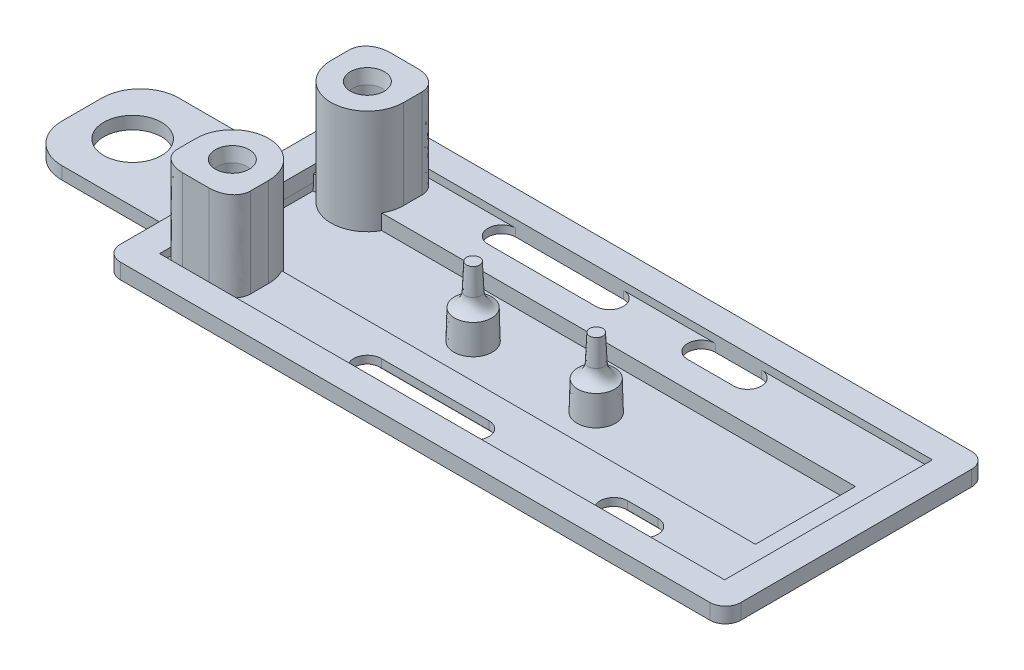
from build123d import *

# Parameters (mm, degrees)
MAINPERIMETER_DEPTH                = 2.54
FILLET1_R                          = 2.54
DEFINESDROPDOWN_DEPTH              = 8.255
FILLSINGAP_DEPTH                   = 2.54
COVERSOPENING_DEPTH                = 1.27
FILLET2_R                          = 3.81
SKETCH8_R                          = 1.587499999999992
TABS_FOR_PERFBOARD_DEPTH           = 11.43
TABS_FOR_PERFBOARD_DRAFT           = 2.5000000000000053
SKETCH8_R_2                        = 1.5875000000000052
TABS_FOR_PERFBOARD_PROFILE_2_DEPTH = 11.43
TABS_FOR_PERFBOARD_PROFILE_2_DRAFT = 2.5000000000000053
SKETCH30_R                         = 3.1750000000000003
BOSS_EXTRUDE12_DEPTH               = 4.826
BOSS_EXTRUDE12_DRAFT               = 1.5000000000000033
SKETCH30_R_2                       = 3.174999999999997
BOSS_EXTRUDE12_PROFILE_2_DEPTH     = 4.826
BOSS_EXTRUDE12_PROFILE_2_DRAFT     = 1.5000000000000033
FILLET6_R                          = 2.54
CUTS_OUT_ROOM_FOR_WIRES_DEPTH      = 1.27
CUT_EXTRUDE4_DEPTH                 = 121.34677900045737
CUT_EXTRUDE5_DEPTH                 = 121.34677906928141
BOSS_EXTRUDE8_START                = -1.27
BOSS_EXTRUDE8_DEPTH                = 15.999627777
BOSS_EXTRUDE8_START_2              = -2.5146
BOSS_EXTRUDE8_2_DEPTH              = 2.249007948
SKETCH16_R                         = 2.41499999999999
CUT_EXTRUDE6_DEPTH                 = 6.35
SKETCH17_R                         = 1.5000000000000018
CUT_EXTRUDE7_DEPTH                 = 1.27
BOSS_EXTRUDE9_START                = -0.265592052
BOSS_EXTRUDE9_DEPTH                = 14.995219829
BOSS_EXTRUDE9_START_2              = -2.5146
BOSS_EXTRUDE9_2_DEPTH              = 2.5146
SKETCH20_R                         = 2.415000000000003
CUT_EXTRUDE8_DEPTH                 = 6.35
SKETCH21_R                         = 1.5000000000000042
CUT_EXTRUDE9_DEPTH                 = 1.27
SKETCH24_W                         = 25.4
SKETCH24_H                         = 19.304000000000023
SKETCH24_R                         = 4.762500000000002
BOSS_EXTRUDE10_DEPTH               = 2.0828
BOSS_EXTRUDE11_REACH               = 137.209
SKETCH26_W                         = 19.304000000000023
SKETCH26_H                         = 2.0828
FILLET3_R                          = 6.35
FILLET5_R                          = 1.27
EXRTATHICKNESS_REACH               = 122.917


with BuildPart() as part:
    # Sketch1 → MainPerimeter (new body)
    with BuildSketch(Plane(origin=(0, 0, 0), x_dir=(1, 0, 0), z_dir=(0, 1, 0))):
        Polygon((-19.553975249358466, -43.67073320607621), (82.83002475064158, -43.67073320607621), (82.83002475064158, -86.85073320607621), (-19.55397524935846, -86.85073320607621), align=None)
        Polygon((-14.981975249358467, -48.24273320607621), (-14.981975249358463, -82.27873320607621), (78.25802475064158, -82.27873320607621), (78.25802475064158, -48.24273320607621), align=None, mode=Mode.SUBTRACT)
    extrude(amount=MAINPERIMETER_DEPTH)

    # Fillet1
    fillet1_edges = [part.edges().sort_by_distance(p)[0] for p in [
        (-19.553975249358466, 1.27, 43.67073320607621),
        (82.83002475064158, 1.27, 43.67073320607621),
        (82.83002475064158, 1.27, 86.85073320607621),
        (-19.55397524935846, 1.27, 86.85073320607621),
    ]]
    fillet(fillet1_edges, radius=FILLET1_R)

    # Sketch5 → DefinesDropDown (add, symmetric)
    with BuildSketch(Plane(origin=(0, 0, 65.26073320607621), x_dir=(-1, 0, 0), z_dir=(0, 0, -1))):
        Polygon((-82.83002475064158, 0), (-78.33192978860663, -3.1496), (15.05588028732352, -3.149599999999991), (19.553975249358466, 9.71e-15), (14.981975249358467, 8.59e-15), (15.05588028732352, -1.2445999999999913), (-78.33192978860663, -1.2446), (-78.25802475064158, 0), align=None)
    extrude(amount=DEFINESDROPDOWN_DEPTH, both=True)

    # Sketch6 → FillsInGap (add)
    with BuildSketch(Plane.XZ):
        Polygon((78.25802475064158, 57.005733206076215), (-14.981975249358468, 57.005733206076194), (-14.981975249358467, 48.24273320607621), (78.25802475064158, 48.24273320607622), align=None)
        Polygon((-14.981975249358463, 82.27873320607621), (78.25802475064158, 82.27873320607621), (78.25802475064158, 73.5157332060762), (-14.981975249358461, 73.51573320607619), align=None)
    extrude(amount=-FILLSINGAP_DEPTH)

    # Sketch7 → CoversOpening (add)
    with BuildSketch(Plane(origin=(0, 0, 57.005733206076215), x_dir=(-1, 0, 0), z_dir=(0, 0, -1))):
        Polygon((-78.25802475064158, 0), (14.981975249358465, 0), (19.553975249358462, 0), (15.05588028732352, -3.149599999999991), (-78.33192978860663, -3.1496), (-82.83002475064158, 0), align=None)
    coversopening = extrude(amount=COVERSOPENING_DEPTH)

    # Mirror1: CoversOpening across plane
    add(coversopening.mirror(Plane(origin=(0, 0, 65.26073320607621), x_dir=(1, 0, 0), z_dir=(0, 0, -1))))

    # Fillet2
    # the kernel refuses this fillet: 3.81 mm, written as the material it adds along each edge
    with BuildSketch(Plane(origin=(92.21084688945389, 0, 74.7857332060762), x_dir=(0, -1, 2.0304e-13), z_dir=(-1, 0, 0))) as fillet2_piece_1_section:
        with BuildLine():
            CenterArc((3.8100000000007617, 3.7523288555241487), FILLET2_R, 179.99999999998838, 80.0183170200956)
            Line((7.6187e-13, 3.7523288555249223), (0, 0))
            Line((0, 0), (3.1496000000001088, 0))
        make_face()
    fillet2_piece_1 = extrude(amount=121.14564427762464, mode=Mode.PRIVATE)
    fillet2_piece_1 = split(fillet2_piece_1, bisect_by=Plane(origin=(55.441346063389844, -52.512289313645795, 74.7857332060762), z_dir=(0.5735764363510469, 0.8191520442889914, 0)), keep=Keep.TOP, mode=Mode.PRIVATE)
    fillet2_piece_1 = split(fillet2_piece_1, bisect_by=Plane(origin=(89.12465088626233, 4.407544670373507, 74.7857332060762), z_dir=(-0.5735764363510469, 0.8191520442889912, 0)), keep=Keep.TOP, mode=Mode.PRIVATE)
    add(fillet2_piece_1)
    with BuildSketch(Plane(origin=(92.21084688945395, 0, 55.73573320607621), x_dir=(0, -1, -2.0981e-13), z_dir=(-1, 0, 0))) as fillet2_piece_2_section:
        with BuildLine():
            CenterArc((3.810000000000787, -3.7523288555241443), FILLET2_R, 99.98168297991637, 80.01831702009565)
            Line((7.8726e-13, -3.7523288555249437), (0, 0))
            Line((0, 0), (3.1496000000001123, 0))
        make_face()
    fillet2_piece_2 = extrude(amount=121.14564427762477, mode=Mode.PRIVATE)
    fillet2_piece_2 = split(fillet2_piece_2, bisect_by=Plane(origin=(55.44134606338988, -52.51228931364583, 55.73573320607621), z_dir=(0.5735764363510469, 0.8191520442889914, 0)), keep=Keep.TOP, mode=Mode.PRIVATE)
    fillet2_piece_2 = split(fillet2_piece_2, bisect_by=Plane(origin=(89.12465088626236, 4.407544670373534, 55.73573320607621), z_dir=(-0.5735764363510469, 0.8191520442889912, 0)), keep=Keep.TOP, mode=Mode.PRIVATE)
    add(fillet2_piece_2)


with BuildPart() as tabs_for_perfboard_tool:
    # Sketch8 → Tabs For PerfBoard (with draft: the straight prism first)
    with BuildSketch(Plane(origin=(-1.2e-16, -1.2445999999999926, 0), x_dir=(1, -1.2e-16, 0), z_dir=(1.2e-16, 1, 0))):
        with Locations((19.60802475064167, -65.26073320607618)):
            Circle(SKETCH8_R)
    extrude(amount=TABS_FOR_PERFBOARD_DEPTH)
    # Tabs For PerfBoard: the draft: its side faces are tilted about the plane it starts from
    tabs_for_perfboard_sides = [tabs_for_perfboard_tool.faces().sort_by_distance(p)[0] for p in [
        (18.020524751, 4.4704, 65.260733206),
    ]]
    draft(tabs_for_perfboard_sides, Plane(origin=(-1.2e-16, -1.2445999999999926, 0), x_dir=(1, -1.2e-16, 0), z_dir=(1.2e-16, 1, 0)), TABS_FOR_PERFBOARD_DRAFT)


with BuildPart() as part_1:
    add(part.part)

    # Tabs For PerfBoard: add tabs_for_perfboard_tool
    add(tabs_for_perfboard_tool.part)


with BuildPart() as tabs_for_perfboard_profile_2_tool:
    # Sketch8 → Tabs For PerfBoard profile 2 (with draft: the straight prism first)
    with BuildSketch(Plane(origin=(-1.2e-16, -1.2445999999999926, 0), x_dir=(1, -1.2e-16, 0), z_dir=(1.2e-16, 1, 0))):
        with Locations((39.928024750641605, -65.2607332060762)):
            Circle(SKETCH8_R_2)
    extrude(amount=TABS_FOR_PERFBOARD_PROFILE_2_DEPTH)
    # Tabs For PerfBoard profile 2: the draft: its side faces are tilted about the plane it starts from
    tabs_for_perfboard_profile_2_sides = [tabs_for_perfboard_profile_2_tool.faces().sort_by_distance(p)[0] for p in [
        (38.340524751, 4.4704, 65.260733206),
    ]]
    draft(tabs_for_perfboard_profile_2_sides, Plane(origin=(-1.2e-16, -1.2445999999999926, 0), x_dir=(1, -1.2e-16, 0), z_dir=(1.2e-16, 1, 0)), TABS_FOR_PERFBOARD_PROFILE_2_DRAFT)


with BuildPart() as part_2:
    add(part_1.part)

    # Tabs For PerfBoard profile 2: add tabs_for_perfboard_profile_2_tool
    add(tabs_for_perfboard_profile_2_tool.part)


with BuildPart() as boss_extrude12_tool:
    # Sketch30 → Boss-Extrude12 (with draft: the straight prism first)
    with BuildSketch(Plane(origin=(-1.2e-16, -1.2445999999999926, 0), x_dir=(1, -9e-17, 0), z_dir=(9e-17, 1, 0))):
        with Locations((19.60802475064167, -65.26073320607618)):
            Circle(SKETCH30_R)
    extrude(amount=BOSS_EXTRUDE12_DEPTH)
    # Boss-Extrude12: the draft: its side faces are tilted about the plane it starts from
    boss_extrude12_sides = [boss_extrude12_tool.faces().sort_by_distance(p)[0] for p in [
        (16.433024751, 1.1684, 65.260733206),
    ]]
    draft(boss_extrude12_sides, Plane(origin=(-1.2e-16, -1.2445999999999926, 0), x_dir=(1, -9e-17, 0), z_dir=(9e-17, 1, 0)), BOSS_EXTRUDE12_DRAFT)


with BuildPart() as part_3:
    add(part_2.part)

    # Boss-Extrude12: add boss_extrude12_tool
    add(boss_extrude12_tool.part)


with BuildPart() as boss_extrude12_profile_2_tool:
    # Sketch30 → Boss-Extrude12 profile 2 (with draft: the straight prism first)
    with BuildSketch(Plane(origin=(-1.2e-16, -1.2445999999999926, 0), x_dir=(1, -9e-17, 0), z_dir=(9e-17, 1, 0))):
        with Locations((39.928024750641605, -65.2607332060762)):
            Circle(SKETCH30_R_2)
    extrude(amount=BOSS_EXTRUDE12_PROFILE_2_DEPTH)
    # Boss-Extrude12 profile 2: the draft: its side faces are tilted about the plane it starts from
    boss_extrude12_profile_2_sides = [boss_extrude12_profile_2_tool.faces().sort_by_distance(p)[0] for p in [
        (36.753024751, 1.1684, 65.260733206),
    ]]
    draft(boss_extrude12_profile_2_sides, Plane(origin=(-1.2e-16, -1.2445999999999926, 0), x_dir=(1, -9e-17, 0), z_dir=(9e-17, 1, 0)), BOSS_EXTRUDE12_PROFILE_2_DRAFT)


with BuildPart() as part_4:
    add(part_3.part)

    # Boss-Extrude12 profile 2: add boss_extrude12_profile_2_tool
    add(boss_extrude12_profile_2_tool.part)

    # Fillet6
    # the kernel refuses this fillet: 2.54 mm, written as the material it adds along each edge
    with BuildSketch(Plane(origin=(19.60802475064167, 3.5814000000000057, 65.26073320607618), x_dir=(1, 0, 0), z_dir=(0, 0, -1))) as fillet6_piece_1:
        with BuildLine():
            CenterArc((3.813460389482792, -2.4221126093668444), FILLET6_R, 107.52462150707703, 69.97537849292297)
            Line((1.2758779066648707, -2.311319365458891), (1.2251262570085117, -2.309103500580732))
            Line((1.2251262570085117, -2.309103500580732), (1.326040639867152, 0.00221586487815939))
            Line((1.326040639867152, 0.00221586487815939), (1.376792289523511, 0.05080000000000062))
            ThreePointArc((1.376792289523511, 0.05080000000000062), (2.212709516015309, 0.05080000000000107), (3.03333006956759, 0.04844225218733822))
            Line((3.03333006956759, 0.04844225218733822), (3.0486267425071034, 1.33e-15))
        make_face()
    revolve(axis=Axis((19.60802475064167, 3.5814000000000057, 65.26073320607618), (-1.2e-16, -1, 0)))
    with BuildSketch(Plane(origin=(39.928024750641605, 3.581400000000003, 65.2607332060762), x_dir=(1, 0, 0), z_dir=(0, 0, -1))) as fillet6_piece_2:
        with BuildLine():
            CenterArc((3.813460389482806, -2.4221126093668417), FILLET6_R, 107.52462150707737, 69.97537849292263)
            Line((1.2758779066648884, -2.311319365458888), (1.225126257008533, -2.309103500580729))
            Line((1.225126257008533, -2.309103500580729), (1.3260406398671734, 0.00221586487815939))
            Line((1.3260406398671734, 0.00221586487815939), (1.3767922895235287, 0.05080000000000062))
            ThreePointArc((1.3767922895235287, 0.05080000000000062), (2.212709516015316, 0.05080000000000018), (3.03333006956759, 0.048442252187336))
            Line((3.03333006956759, 0.048442252187336), (3.0486267425071034, -8.9e-16))
        make_face()
    revolve(axis=Axis((39.928024750641605, 3.581400000000003, 65.2607332060762), (-1.2e-16, -1, 0)))

    # Sketch10 → Cuts out room for wires (cut)
    with BuildSketch(Plane(origin=(0, 2.54, 0), x_dir=(1, 0, 0), z_dir=(0, 1, 0))):
        Polygon((-14.981975249358465, -73.51573320607619), (78.25802475064158, -73.51573320607619), (78.25802475064158, -82.40573320607619), (-14.981975249358461, -82.40573320607619), align=None)
        Polygon((-14.981975249358465, -57.005733206076194), (78.25802475064158, -57.005733206076194), (78.25802475064158, -48.11573320607619), (-14.981975249358468, -48.11573320607619), align=None)
    extrude(amount=-CUTS_OUT_ROOM_FOR_WIRES_DEPTH, mode=Mode.SUBTRACT)

    # Sketch13 → Cut-Extrude4 (cut, through all)
    with BuildSketch(Plane(origin=(0, 1.27, 0), x_dir=(1, 0, 0), z_dir=(0, 1, 0))):
        with BuildLine():
            Line((9.494352429360799, -48.11573320607619), (27.274352429360796, -48.11573320607619))
            ThreePointArc((27.274352429360796, -48.11573320607619), (29.56035242936079, -50.40173320607619), (27.274352429360796, -52.68773320607618))
            Line((27.274352429360796, -52.68773320607618), (9.494352429360799, -52.68773320607618))
            ThreePointArc((9.494352429360799, -52.68773320607618), (7.208352429360804, -50.40173320607619), (9.494352429360799, -48.11573320607619))
        make_face()
        with BuildLine():
            Line((50.05133187830864, -52.687733206076174), (42.43133187830864, -52.68773320607619))
            ThreePointArc((42.43133187830864, -52.68773320607619), (40.14533187830864, -50.40173320607619), (42.43133187830864, -48.115733206076186))
            Line((42.43133187830864, -48.115733206076186), (50.05133187830864, -48.1157332060762))
            ThreePointArc((50.05133187830864, -48.1157332060762), (52.337331878308625, -50.40173320607619), (50.05133187830864, -52.687733206076174))
        make_face()
    extrude(amount=-CUT_EXTRUDE4_DEPTH, mode=Mode.SUBTRACT)

    # Sketch14 → Cut-Extrude5 (cut, through all)
    with BuildSketch(Plane(origin=(0, 1.27, 0), x_dir=(1, 0, 0), z_dir=(0, 1, 0))):
        with BuildLine():
            Line((34.792501416206356, -82.40573320607618), (17.03997823283491, -82.40573320607618))
            ThreePointArc((17.03997823283491, -82.40573320607618), (14.753978232834921, -80.11973320607618), (17.03997823283491, -77.83373320607619))
            Line((17.03997823283491, -77.83373320607619), (34.792501416206356, -77.83373320607619))
            ThreePointArc((34.792501416206356, -77.83373320607619), (37.07850141620636, -80.11973320607618), (34.792501416206356, -82.40573320607618))
        make_face()
        with BuildLine():
            Line((62.700122861732986, -82.40573320607619), (57.69812875881367, -82.40573320607619))
            ThreePointArc((57.69812875881367, -82.40573320607619), (55.412128758813665, -80.11973320607618), (57.69812875881367, -77.83373320607618))
            Line((57.69812875881367, -77.83373320607618), (62.700122861732986, -77.83373320607618))
            ThreePointArc((62.700122861732986, -77.83373320607618), (64.98612286173301, -80.11973320607618), (62.700122861732986, -82.40573320607619))
        make_face()
    extrude(amount=-CUT_EXTRUDE5_DEPTH, mode=Mode.SUBTRACT)

    # Boss-Extrude8: read off the stored shape, not the designer's step
    # Boss-Extrude8 outline → Boss-Extrude8 (add)
    with BuildSketch(Plane(origin=(0, 1.27, 0), x_dir=(1, 0, 0), z_dir=(0, 1, 0)).offset(BOSS_EXTRUDE8_START)):
        with BuildLine():
            Line((-11.171975249, -82.405733206), (-6.791975249, -82.405733206))
            add(Edge.make_bspline(
                [(-6.791975249, -82.405733206), (-4.96554354646591, -82.4057332060762), (-2.98197524935846, -81.3940897771439), (-2.981975249, -79.405733206)],
                knots=[0, 0, 0, 0, 1, 1, 1, 1], degree=3))
            Line((-2.981975249, -79.405733206), (-2.981975249, -76.405733206))
            ThreePointArc((-2.981975249, -76.405733206), (-8.981975249, -70.405733206), (-14.981975249, -76.405733206))
            Line((-14.981975249, -76.405733206), (-14.981975249, -79.405733206))
            add(Edge.make_bspline(
                [(-14.981975249, -79.405733206), (-14.9819752493585, -81.3940897771439), (-12.998406952251, -82.4057332060762), (-11.171975249, -82.405733206)],
                knots=[0, 0, 0, 0, 1, 1, 1, 1], degree=3))
        make_face()
    extrude(amount=BOSS_EXTRUDE8_DEPTH)

    # Boss-Extrude8 2 outline → Boss-Extrude8 2 (add)
    with BuildSketch(Plane(origin=(0, 1.27, 0), x_dir=(1, 0, 0), z_dir=(0, 1, 0)).offset(BOSS_EXTRUDE8_START_2)):
        with BuildLine():
            Line((-14.240102292, -73.515733206), (-3.723848206, -73.515733206))
            ThreePointArc((-3.723848206, -73.515733206), (-8.981975249, -70.405733206), (-14.240102292, -73.515733206))
        make_face()
    extrude(amount=BOSS_EXTRUDE8_2_DEPTH)

    # Sketch16 → Cut-Extrude6 (cut)
    with BuildSketch(Plane(origin=(0, 15.999627777317047, 0), x_dir=(1, 0, 0), z_dir=(0, 1, 0))):
        with Locations(Location((-8.981975249358465, -76.40573320607619, 0), (0, 0, 270))):
            Circle(SKETCH16_R)
    extrude(amount=-CUT_EXTRUDE6_DEPTH, mode=Mode.SUBTRACT)

    # Sketch17 → Cut-Extrude7 (cut)
    with BuildSketch(Plane(origin=(0, 9.649627777317047, 0), x_dir=(1, 0, 0), z_dir=(0, 1, 0))):
        with Locations(Location((-8.981975249358465, -76.40573320607619, 0), (0, 0, 270))):
            Circle(SKETCH17_R)
    extrude(amount=-CUT_EXTRUDE7_DEPTH, mode=Mode.SUBTRACT)

    # Sketch18 → Cut-Revolve1 (revolve, cut)
    with BuildSketch(Plane(origin=(1.228e-14, 0, 76.40573320607619), x_dir=(0, 1, 0), z_dir=(1.6e-16, 0, 1)), mode=Mode.PRIVATE) as cut_revolve1_sk:
        Polygon((15.999627777317047, 11.781975249358476), (9.649627777317045, 10.662298921859696), (9.649627777317047, 8.981975249358475), (15.999627777317047, 8.981975249358475), align=None)
    revolve(cut_revolve1_sk.sketch.rotate(Axis((-8.981975249358465, 9.649627777317047, 76.40573320607619), (0, 1, 0)), 90), axis=Axis((-8.981975249358465, 9.649627777317047, 76.40573320607619), (0, 1, 0)), mode=Mode.SUBTRACT)

    # Boss-Extrude9: read off the stored shape, not the designer's step
    # Boss-Extrude9 outline → Boss-Extrude9 (add)
    with BuildSketch(Plane(origin=(0, 1.27, 0), x_dir=(1, 0, 0), z_dir=(0, 1, 0)).offset(BOSS_EXTRUDE9_START)):
        with BuildLine():
            Line((-6.791975249, -48.115733206), (-11.171975249, -48.115733206))
            add(Edge.make_bspline(
                [(-11.171975249, -48.115733206), (-13.5567405860582, -48.1157332060762), (-14.9819752493585, -49.5094753216516), (-14.981975249, -51.115733206)],
                knots=[0, 0, 0, 0, 1, 1, 1, 1], degree=3))
            Line((-14.981975249, -51.115733206), (-14.981975249, -54.115733206))
            ThreePointArc((-14.981975249, -54.115733206), (-8.981975249, -60.115733206), (-2.981975249, -54.115733206))
            Line((-2.981975249, -54.115733206), (-2.981975249, -51.115733206))
            add(Edge.make_bspline(
                [(-2.981975249, -51.115733206), (-2.98197524935846, -49.5094753216516), (-4.40720991265868, -48.1157332060762), (-6.791975249, -48.115733206)],
                knots=[0, 0, 0, 0, 1, 1, 1, 1], degree=3))
        make_face()
    extrude(amount=BOSS_EXTRUDE9_DEPTH)

    # Boss-Extrude9 2 outline → Boss-Extrude9 2 (add)
    with BuildSketch(Plane(origin=(0, 1.27, 0), x_dir=(1, 0, 0), z_dir=(0, 1, 0)).offset(BOSS_EXTRUDE9_START_2)):
        with BuildLine():
            Line((-3.723848206, -57.005733206), (-14.240102292, -57.005733206))
            ThreePointArc((-14.240102292, -57.005733206), (-8.981975249, -60.115733206), (-3.723848206, -57.005733206))
        make_face()
    extrude(amount=BOSS_EXTRUDE9_2_DEPTH)

    # Sketch20 → Cut-Extrude8 (cut)
    with BuildSketch(Plane(origin=(0, 15.999627777317047, 0), x_dir=(1, 0, 0), z_dir=(0, 1, 0))):
        with Locations(Location((-8.981975249358465, -54.11573320607619, 0), (0, 0, 270))):
            Circle(SKETCH20_R)
    extrude(amount=-CUT_EXTRUDE8_DEPTH, mode=Mode.SUBTRACT)

    # Sketch21 → Cut-Extrude9 (cut)
    with BuildSketch(Plane(origin=(0, 9.649627777317047, 0), x_dir=(1, 0, 0), z_dir=(0, 1, 0))):
        with Locations(Location((-8.981975249358465, -54.11573320607619, 0), (0, 0, 270))):
            Circle(SKETCH21_R)
    extrude(amount=-CUT_EXTRUDE9_DEPTH, mode=Mode.SUBTRACT)

    # Sketch22 → Cut-Revolve2 (revolve, cut)
    with BuildSketch(Plane.YX.offset(-54.11573320607619), mode=Mode.PRIVATE) as cut_revolve2_sk:
        Polygon((15.999627777317047, -6.181975249358464), (9.649627777317049, -7.301651576857245), (9.649627777317047, -8.981975249358465), (15.999627777317047, -8.981975249358465), align=None)
    revolve(cut_revolve2_sk.sketch.rotate(Axis((-8.981975249358465, 9.649627777317047, 54.11573320607619), (0, 1, 0)), 270), axis=Axis((-8.981975249358465, 9.649627777317047, 54.11573320607619), (0, 1, 0)), mode=Mode.SUBTRACT)



with BuildPart() as body_2:
    # Sketch24 → Boss-Extrude10 (new body)
    with BuildSketch(Plane.XZ.offset(2.514599999999992)):
        with Locations((-32.25397524935846, 65.26073320607621)):
            Rectangle(SKETCH24_W, SKETCH24_H)
        with Locations((-36.57197524935847, 65.26073320607621)):
            Circle(SKETCH24_R, mode=Mode.SUBTRACT)
    extrude(amount=-BOSS_EXTRUDE10_DEPTH)


with BuildPart() as part_5:
    add(part_4.part)

    add(body_2.part)  # Boss-Extrude11 merges body 2
    # Boss-Extrude11: up to this plane
    boss_extrude11_end = Plane(origin=(-19.553975249358466, 9.71e-15, 57.005733206076215), z_dir=(-0.5735764363510478, -0.8191520442889907, 0))
    # Sketch26 → Boss-Extrude11 (add, up to the surface)
    with BuildSketch(Plane(origin=(-19.553975249358466, 2.41e-15, 0), x_dir=(0, 0, -1), z_dir=(1, -1.2e-16, 0)), mode=Mode.PRIVATE) as boss_extrude11_sk1:
        with Locations((-65.26073320607621, -1.4731999999999925)):
            Rectangle(SKETCH26_W, SKETCH26_H)
    boss_extrude11_tool1 = split(extrude(boss_extrude11_sk1.sketch, amount=BOSS_EXTRUDE11_REACH, mode=Mode.PRIVATE), bisect_by=boss_extrude11_end, keep=Keep.BOTH, mode=Mode.PRIVATE)
    add(boss_extrude11_tool1.solids().sort_by_distance((-19.553975, -1.4732, 65.260733))[0])

    # Fillet3
    # the kernel refuses this fillet: 6.35 mm, written as the material it adds along each edge
    with BuildSketch(Plane(origin=(-18.937300940047223, -0.4317999999999903, 55.6087332060762), x_dir=(-0.8191520442921021, 0.573576436346604, 0), z_dir=(0, 0, 1))) as fillet3_piece_1:
        with BuildLine():
            CenterArc((6.032728958479463, -3.527756345951232), FILLET3_R, 124.99999999968931, 21.25124397565753)
            Line((2.390518587678528, 1.6738591353036156), (0, 0))
            Line((0, 0), (0.7528203263532598, -1e-17))
        make_face()
    extrude(amount=19.304000000000023)
    # the kernel refuses this fillet: 6.35 mm, written as the material it takes off along each edge
    with BuildSketch(Plane(origin=(-44.953975249358464, -18.38959999999999, 55.6087332060762), x_dir=(0, 0, 1), z_dir=(1.2e-16, 1, 0))) as fillet3_2_piece_1:
        with BuildLine():
            CenterArc((FILLET3_R, FILLET3_R), FILLET3_R, 180, 90)
            Line((0, FILLET3_R), (0, 0))
            Line((0, 0), (FILLET3_R, 0))
        make_face()
    extrude(amount=33.832800000000006, mode=Mode.SUBTRACT)
    with BuildSketch(Plane(origin=(-44.953975249358464, -18.38959999999999, 74.91273320607623), x_dir=(1, -1.2e-16, 0), z_dir=(1.2e-16, 1, 0))) as fillet3_2_piece_2:
        with BuildLine():
            CenterArc((FILLET3_R, FILLET3_R), FILLET3_R, 180, 90)
            Line((0, FILLET3_R), (0, 0))
            Line((0, 0), (FILLET3_R, 0))
        make_face()
    extrude(amount=33.832800000000006, mode=Mode.SUBTRACT)

    # Fillet5
    # the kernel refuses this fillet: 1.27 mm, written as the material it adds along each edge
    with BuildSketch(Plane(origin=(-15.962754271604759, -2.5145999999999917, 74.91273320607623), x_dir=(0.819152044283458, -0.5735764363589492, 0), z_dir=(0, 0, -1))) as fillet5_piece_1_section:
        with BuildLine():
            CenterArc((FILLET5_R * 0.315298788889, FILLET5_R), FILLET5_R, 234.99999999954787, 34.999999999896886)
            Line((-FILLET5_R * 0.258277647469, FILLET5_R * 0.180847955716), (0, 0))
            Line((0, 0), (FILLET5_R * 0.315298788879, -3e-17))
        make_face()
    fillet5_piece_1 = extrude(amount=19.304000000000023, mode=Mode.PRIVATE)
    fillet5_piece_1 = fillet5_piece_1 - Plane(origin=(-15.962754271604759, -3.810000000001, 51.983404350552), x_dir=(0, -1, 0), z_dir=(1, 0, 0)) * Cylinder(3.81, 41, mode=Mode.PRIVATE)
    fillet5_piece_1 = fillet5_piece_1 - Plane(origin=(-15.962754271604759, -3.810000000001, 78.5380620616), x_dir=(0, -1, 0), z_dir=(1, 0, 0)) * Cylinder(3.81, 41, mode=Mode.PRIVATE)
    add(fillet5_piece_1)

    # Sketch25 → ExrtaThickness (add, up to next)
    with BuildSketch(Plane(origin=(0, 1.27, 0), x_dir=(1, 0, 0), z_dir=(0, 1, 0)), mode=Mode.PRIVATE) as exrtathickness_sk1:
        Polygon((78.25802475064158, -57.005733206076194), (74.4480247506416, -57.005733206076194), (74.44802475064158, -73.5157332060762), (78.25802475064158, -73.5157332060762), align=None)
    exrtathickness_tool1 = extrude(exrtathickness_sk1.sketch, amount=-EXRTATHICKNESS_REACH, mode=Mode.PRIVATE) - part_5.part
    add(exrtathickness_tool1.solids().sort_by_distance((76.353025, 1.27, 65.260733))[0])


solid = part_5.part
